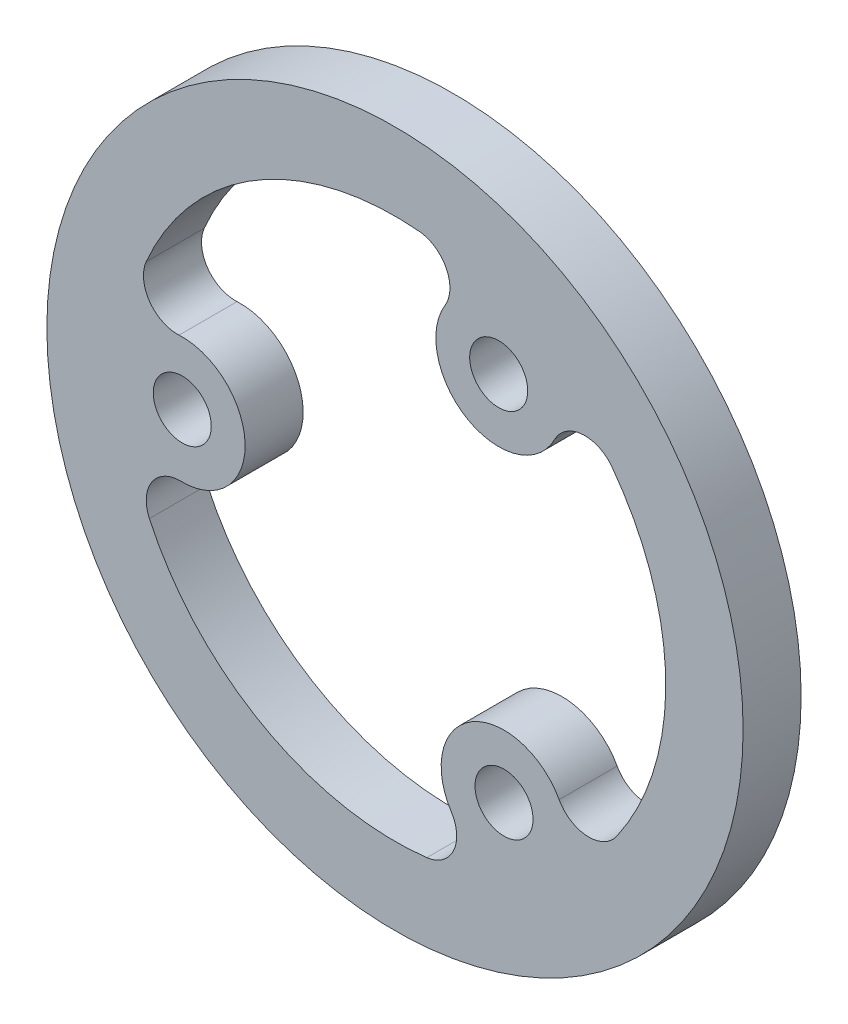
from build123d import *

# Parameters (mm, degrees)
ESQUISSE1_R        = 18
ESQUISSE1_R_2      = 1.5
BOSS_EXTRU_1_DEPTH = 3


with BuildPart() as part:
    # Esquisse1 → Boss.-Extru.1 (new body)
    with BuildSketch(Plane.XY):
        Circle(ESQUISSE1_R)
        with Locations((-10.998860664, -0.15831643)):
            Circle(ESQUISSE1_R_2, mode=Mode.SUBTRACT)
        with Locations((5.362324282, 9.604450963)):
            Circle(ESQUISSE1_R_2, mode=Mode.SUBTRACT)
        with Locations((5.636536382, -9.446134533)):
            Circle(ESQUISSE1_R_2, mode=Mode.SUBTRACT)
        with BuildLine():
            ThreePointArc((-11.072133243, -3.407490345), (-7.749197286, -0.111541121), (-11.165620039, 3.087402491))
            ThreePointArc((-11.165620039, 3.087402491), (-12.691606715, 3.835172702), (-12.86332977, 5.525825479))
            ThreePointArc((-12.86332977, 5.525825479), (-7.173773577, 12.022353042), (1.245327334, 13.944502853))
            ThreePointArc((1.245327334, 13.944502853), (2.651653429, 12.990541357), (2.58509342, 11.292493835))
            ThreePointArc((2.58509342, 11.292493835), (3.778001199, 6.766772269), (8.256579008, 8.126009358))
            ThreePointArc((8.256579008, 8.126009358), (9.667160345, 9.073667479), (11.217170127, 8.377057619))
            ThreePointArc((11.217170127, 8.377057619), (13.998549936, 0.201493638), (11.453630047, -8.050736534))
            ThreePointArc((11.453630047, -8.050736534), (9.92431211, -8.79166991), (8.487039823, -7.88500349))
            ThreePointArc((8.487039823, -7.88500349), (3.971196087, -6.655231148), (2.909041031, -11.213411848))
            ThreePointArc((2.909041031, -11.213411848), (3.02444637, -12.90884018), (1.646159643, -13.902883098))
            ThreePointArc((1.646159643, -13.902883098), (-6.824776359, -12.22384668), (-12.698957381, -5.893766319))
            ThreePointArc((-12.698957381, -5.893766319), (-12.575965538, -4.198871447), (-11.072133243, -3.407490345))
        make_face(mode=Mode.SUBTRACT)
    extrude(amount=BOSS_EXTRU_1_DEPTH)


solid = part.part
